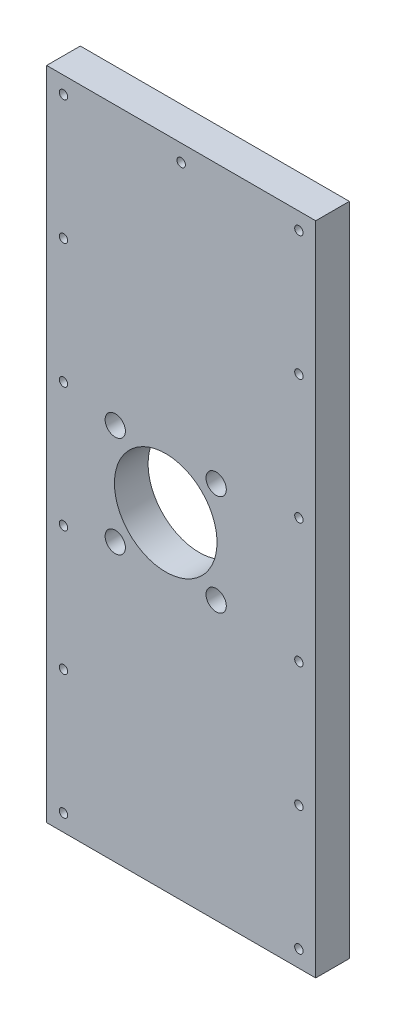
from build123d import *

# Parameters (mm, degrees)
SKIZZE1_W                       = 80
SKIZZE1_H                       = 195
AUFSATZ_LINEAR_AUSTRAGEN1_DEPTH = 10
SKIZZE2_R                       = 3.015
SKIZZE2_R_2                     = 15.25
SCHNITT_LINEAR_AUSTRAGEN1_DEPTH = 10
SKIZZE3_R                       = 2.5
SCHNITT_LINEAR_AUSTRAGEN2_DEPTH = 5
SKIZZE6_R                       = 1.25
SCHNITT_LINEAR_AUSTRAGEN4_DEPTH = 5


with BuildPart() as part:
    # Skizze1 → Aufsatz-Linear austragen1 (new body)
    with BuildSketch(Plane.XY):
        with Locations((-29.059385344, -27.400468384)):
            Rectangle(SKIZZE1_W, SKIZZE1_H)
    extrude(amount=-AUFSATZ_LINEAR_AUSTRAGEN1_DEPTH)

    # Skizze2 → Schnitt-Linear austragen1 (cut)
    with BuildSketch(Plane(origin=(0, 0, -10), x_dir=(-1, 0, 0), z_dir=(0, 0, -1))):
        with Locations((18.659385344, -12.400468384)):
            Circle(SKIZZE2_R)
        with Locations((48.659385344, -12.400468384)):
            Circle(SKIZZE2_R)
        with Locations((18.659385344, -42.400468384)):
            Circle(SKIZZE2_R)
        with Locations((48.659385344, -42.400468384)):
            Circle(SKIZZE2_R)
        with Locations((33.659385344, -27.400468384)):
            Circle(SKIZZE2_R_2)
    extrude(amount=-SCHNITT_LINEAR_AUSTRAGEN1_DEPTH, mode=Mode.SUBTRACT)

    # Skizze3 → Schnitt-Linear austragen2 (cut)
    with BuildSketch(Plane(origin=(0, 0, -10), x_dir=(-1, 0, 0), z_dir=(0, 0, -1))):
        with Locations((29.059385344, 65.099531616)):
            Circle(SKIZZE3_R)
        with Locations((-5.940614656, 65.099531616)):
            Circle(SKIZZE3_R)
        with Locations((64.059385344, 65.099531616)):
            Circle(SKIZZE3_R)
        with Locations((29.059385344, -119.900468384)):
            Circle(SKIZZE3_R)
        with Locations((-5.940614656, -119.900468384)):
            Circle(SKIZZE3_R)
        with Locations((64.059385344, -119.900468384)):
            Circle(SKIZZE3_R)
        with Locations((-5.940614656, 28.099531616)):
            Circle(SKIZZE3_R)
        with Locations((-5.940614656, -8.900468384)):
            Circle(SKIZZE3_R)
        with Locations((-5.940614656, -45.900468384)):
            Circle(SKIZZE3_R)
        with Locations((-5.940614656, -82.900468384)):
            Circle(SKIZZE3_R)
        with Locations((64.059385344, -82.900468384)):
            Circle(SKIZZE3_R)
        with Locations((64.059385344, -45.900468384)):
            Circle(SKIZZE3_R)
        with Locations((64.059385344, -8.900468384)):
            Circle(SKIZZE3_R)
        with Locations((64.059385344, 28.099531616)):
            Circle(SKIZZE3_R)
    extrude(amount=-SCHNITT_LINEAR_AUSTRAGEN2_DEPTH, mode=Mode.SUBTRACT)

    # Skizze6 → Schnitt-Linear austragen4 (cut)
    with BuildSketch(Plane.XY):
        with Locations((-64.059385344, 65.099531616)):
            Circle(SKIZZE6_R)
        with Locations((-29.059385344, 65.099531616)):
            Circle(SKIZZE6_R)
        with Locations((5.940614656, 65.099531616)):
            Circle(SKIZZE6_R)
        with Locations((-64.059385344, 28.099531616)):
            Circle(SKIZZE6_R)
        with Locations((-64.059385344, -8.900468384)):
            Circle(SKIZZE6_R)
        with Locations((-64.059385344, -45.900468384)):
            Circle(SKIZZE6_R)
        with Locations((-64.059385344, -82.900468384)):
            Circle(SKIZZE6_R)
        with Locations((-64.059385344, -119.900468384)):
            Circle(SKIZZE6_R)
        with Locations((5.940614656, -119.900468384)):
            Circle(SKIZZE6_R)
        with Locations((5.940614656, -82.900468384)):
            Circle(SKIZZE6_R)
        with Locations((5.940614656, -45.900468384)):
            Circle(SKIZZE6_R)
        with Locations((5.940614656, -8.900468384)):
            Circle(SKIZZE6_R)
        with Locations((5.940614656, 28.099531616)):
            Circle(SKIZZE6_R)
    extrude(amount=-SCHNITT_LINEAR_AUSTRAGEN4_DEPTH, mode=Mode.SUBTRACT)


solid = part.part
